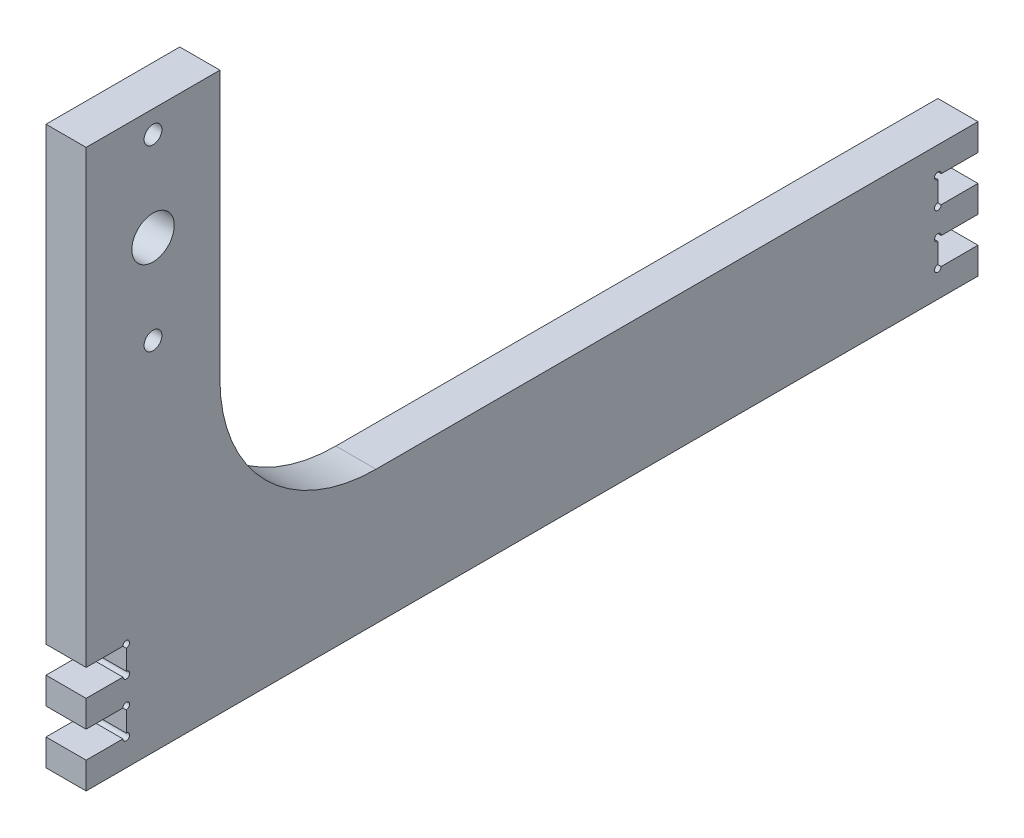
from build123d import *

# Parameters (mm, degrees)
SKETCH1_R           = 4
BOSS_EXTRUDE1_DEPTH = 18
CUT_EXTRUDE1_REACH  = 448.905
SKETCH3_R           = 9.5


with BuildPart() as part:
    # Sketch1 → Boss-Extrude1 (new body)
    with BuildSketch(Plane(origin=(0, 0, 0), x_dir=(0, 0, -1), z_dir=(1, 0, 0))):
        with BuildLine():
            Line((-30, -238), (-30, -250))
            Line((-30, -250), (370, -250))
            Line((370, -250), (370, -238))
            Line((370, -238), (353.5, -238))
            ThreePointArc((353.5, -238), (350.939339828, -239.060660172), (352, -236.5))
            Line((352, -236.5), (352, -227.5))
            ThreePointArc((352, -227.5), (350.939339828, -224.939339828), (353.5, -226))
            Line((353.5, -226), (370, -226))
            Line((370, -226), (370, -214))
            Line((370, -214), (353.5, -214))
            ThreePointArc((353.5, -214), (350.939339828, -215.060660172), (352, -212.5))
            Line((352, -212.5), (352, -203.5))
            ThreePointArc((352, -203.5), (350.939339828, -200.939339828), (353.5, -202))
            Line((353.5, -202), (370, -202))
            Line((370, -202), (370, -190))
            Line((370, -190), (100, -190))
            ThreePointArc((100, -190), (50.502525317, -169.497474683), (30, -120))
            Line((30, -120), (30, 0))
            Line((30, 0), (-30, 0))
            Line((-30, 0), (-30, -202))
            Line((-30, -202), (-13.5, -202))
            ThreePointArc((-13.5, -202), (-10.939339828, -200.939339828), (-12, -203.5))
            Line((-12, -203.5), (-12, -212.5))
            ThreePointArc((-12, -212.5), (-10.939339828, -215.060660172), (-13.5, -214))
            Line((-13.5, -214), (-30, -214))
            Line((-30, -214), (-30, -226))
            Line((-30, -226), (-13.5, -226))
            ThreePointArc((-13.5, -226), (-10.939339828, -224.939339828), (-12, -227.5))
            Line((-12, -227.5), (-12, -236.5))
            ThreePointArc((-12, -236.5), (-10.939339828, -239.060660172), (-13.5, -238))
            Line((-13.5, -238), (-30, -238))
        make_face()
        with Locations((0, -90)):
            Circle(SKETCH1_R, mode=Mode.SUBTRACT)
        with Locations((0, -50)):
            Circle(SKETCH1_R, mode=Mode.SUBTRACT)
        with Locations((0, -10)):
            Circle(SKETCH1_R, mode=Mode.SUBTRACT)
    extrude(amount=BOSS_EXTRUDE1_DEPTH)

    # Sketch3 → Cut-Extrude1 (cut, up to next)
    with BuildSketch(Plane(origin=(18, 0, 0), x_dir=(0, 0, -1), z_dir=(1, 0, 0)), mode=Mode.PRIVATE) as cut_extrude1_sk1:
        with Locations((0, -50)):
            Circle(SKETCH3_R)
    cut_extrude1_tool1 = extrude(cut_extrude1_sk1.sketch, amount=-CUT_EXTRUDE1_REACH, mode=Mode.PRIVATE) & part.part
    add(cut_extrude1_tool1.solids().sort_by_distance((18, -50, 0))[0], mode=Mode.SUBTRACT)


solid = part.part
